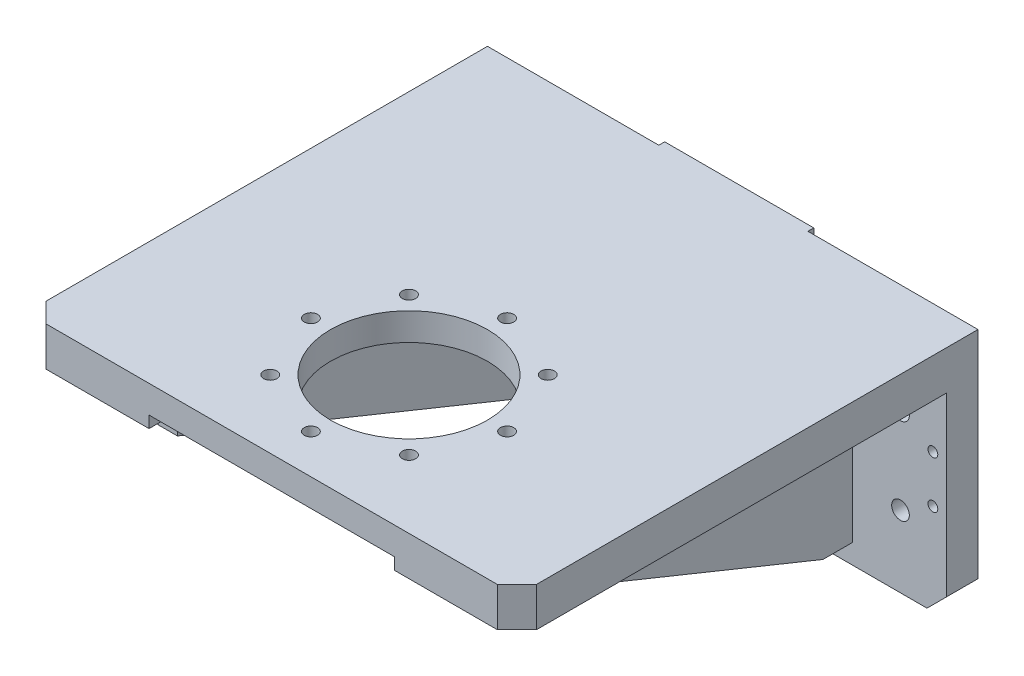
from build123d import *

# Parameters (mm, degrees)
SKETCH1_W                         = 250
SKETCH1_H                         = 120
BOSS_EXTRUDE1_DEPTH               = 16
SKETCH2_W                         = 250
SKETCH2_H                         = 20
BOSS_EXTRUDE2_DEPTH               = 235
GUSSET1_START                     = 192
GUSSET1_DEPTH                     = 10
GUSSET2_START                     = 48
GUSSET2_DEPTH                     = 10
SKETCH5_W                         = 76
SKETCH5_H                         = 120
BOSS_EXTRUDE3_DEPTH               = 3
SKETCH6_W                         = 125
SKETCH6_H                         = 140
CUT_EXTRUDE1_DEPTH                = 6
SKETCH7_R                         = 40
CUT_EXTRUDE2_DEPTH                = 360.111403328
SKETCH10_W                        = 3.4
SKETCH10_H                        = 14
M8_TAPPED_HOLE1_AT_2_COUNT        = 2
M8_TAPPED_HOLE1_AT_2_PITCH        = 70.710678119
M8_TAPPED_HOLE1_AT_3_COUNT        = 2
M8_TAPPED_HOLE1_AT_3_PITCH        = 100
M8_TAPPED_HOLE1_AT_4_COUNT        = 2
M8_TAPPED_HOLE1_AT_4_PITCH        = 70.710678119
M8_TAPPED_HOLE1_AT_5_COUNT        = 2
M8_TAPPED_HOLE1_AT_5_PITCH        = 92.387953251
M8_TAPPED_HOLE1_AT_6_COUNT        = 2
M8_TAPPED_HOLE1_AT_6_PITCH        = 38.268343237
M8_TAPPED_HOLE1_AT_7_COUNT        = 2
M8_TAPPED_HOLE1_AT_7_PITCH        = 92.387953251
M8_TAPPED_HOLE1_AT_8_COUNT        = 2
M8_TAPPED_HOLE1_AT_8_PITCH        = 38.268343237
M5_TAPPED_HOLE1_AT_2_COUNT        = 2
M5_TAPPED_HOLE1_AT_2_PITCH        = 44.345519866
SKETCH16_W                        = 4.5
SKETCH16_H                        = 19
F_9_0_9_DIAMETER_HOLE1_AT_2_COUNT = 2
F_9_0_9_DIAMETER_HOLE1_AT_2_PITCH = 44
F_9_0_9_DIAMETER_HOLE1_AT_3_COUNT = 2
F_9_0_9_DIAMETER_HOLE1_AT_3_PITCH = 57
F_9_0_9_DIAMETER_HOLE1_AT_4_COUNT = 2
F_9_0_9_DIAMETER_HOLE1_AT_4_PITCH = 72.00694411
F_9_0_9_DIAMETER_HOLE1_AT_5_COUNT = 2
F_9_0_9_DIAMETER_HOLE1_AT_5_PITCH = 146
F_9_0_9_DIAMETER_HOLE1_AT_6_COUNT = 2
F_9_0_9_DIAMETER_HOLE1_AT_6_PITCH = 152.486064937
F_9_0_9_DIAMETER_HOLE1_AT_7_COUNT = 2
F_9_0_9_DIAMETER_HOLE1_AT_7_PITCH = 203
F_9_0_9_DIAMETER_HOLE1_AT_8_COUNT = 2
F_9_0_9_DIAMETER_HOLE1_AT_8_PITCH = 207.713745332
SKETCH18_W                        = 2.5
SKETCH18_H                        = 19
TAP_DRILL_FOR_M6_TAP1_AT_2_COUNT  = 2
TAP_DRILL_FOR_M6_TAP1_AT_2_PITCH  = 24
TAP_DRILL_FOR_M6_TAP1_AT_3_COUNT  = 2
TAP_DRILL_FOR_M6_TAP1_AT_3_PITCH  = 236
TAP_DRILL_FOR_M6_TAP1_AT_4_COUNT  = 2
TAP_DRILL_FOR_M6_TAP1_AT_4_PITCH  = 237.217200051
CHAMFER1_SIZE                     = 10


# Read off the part's stored shape, not the designer's step: Gusset1, Gusset2
with BuildPart() as part:
    # Sketch1 → Boss-Extrude1 (new body)
    with BuildSketch(Plane.XY):
        with Locations((125, 60)):
            Rectangle(SKETCH1_W, SKETCH1_H)
    extrude(amount=BOSS_EXTRUDE1_DEPTH)

    # Sketch2 → Boss-Extrude2 (add)
    with BuildSketch(Plane.XY):
        with Locations((125, 110)):
            Rectangle(SKETCH2_W, SKETCH2_H)
    extrude(amount=BOSS_EXTRUDE2_DEPTH)

    # Sketch5 → Boss-Extrude3 (add)
    with BuildSketch(Plane(origin=(0, 0, 0), x_dir=(-1, 0, 0), z_dir=(0, 0, -1))):
        with Locations((-125.298445595, 60)):
            Rectangle(SKETCH5_W, SKETCH5_H)
    extrude(amount=BOSS_EXTRUDE3_DEPTH)

    # Sketch6 → Cut-Extrude1 (cut)
    with BuildSketch(Plane.XZ.offset(-100)):
        with Locations((125, 165)):
            Rectangle(SKETCH6_W, SKETCH6_H)
    extrude(amount=-CUT_EXTRUDE1_DEPTH, mode=Mode.SUBTRACT)

    # Sketch7 → Cut-Extrude2 (cut, through all)
    with BuildSketch(Plane.XZ.offset(-106)):
        with Locations(Location((125, 165, 0), (0, 0, 270))):
            Circle(SKETCH7_R)
    extrude(amount=-CUT_EXTRUDE2_DEPTH, mode=Mode.SUBTRACT)

    # Sketch10 → M8 Tapped Hole1 (revolve, cut)
    with BuildSketch(Plane(origin=(125, 106, 215), x_dir=(0, 0, -1), z_dir=(1, 0, 0))):
        with Locations((1.7, 7)):
            Rectangle(SKETCH10_W, SKETCH10_H)
    m8_tapped_hole1 = revolve(axis=Axis((125, 99.65, 215), (0, 1, 0)), mode=Mode.SUBTRACT)

    # M8 Tapped Hole1 at 2: M8 Tapped Hole1 ×2
    with Locations(*[Vector(-0.7071067811865476, 0, -0.7071067811865476) * (i * M8_TAPPED_HOLE1_AT_2_PITCH) for i in range(1, M8_TAPPED_HOLE1_AT_2_COUNT)]):
        add(m8_tapped_hole1, mode=Mode.SUBTRACT)

    # M8 Tapped Hole1 at 3: M8 Tapped Hole1 ×2
    with Locations(*[(0, 0, -i * M8_TAPPED_HOLE1_AT_3_PITCH) for i in range(1, M8_TAPPED_HOLE1_AT_3_COUNT)]):
        add(m8_tapped_hole1, mode=Mode.SUBTRACT)

    # M8 Tapped Hole1 at 4: M8 Tapped Hole1 ×2
    with Locations(*[Vector(0.7071067811865477, 0, -0.7071067811865475) * (i * M8_TAPPED_HOLE1_AT_4_PITCH) for i in range(1, M8_TAPPED_HOLE1_AT_4_COUNT)]):
        add(m8_tapped_hole1, mode=Mode.SUBTRACT)

    # M8 Tapped Hole1 at 5: M8 Tapped Hole1 ×2
    with Locations(*[Vector(-0.38268343236508917, 0, -0.9238795325112871) * (i * M8_TAPPED_HOLE1_AT_5_PITCH) for i in range(1, M8_TAPPED_HOLE1_AT_5_COUNT)]):
        add(m8_tapped_hole1, mode=Mode.SUBTRACT)

    # M8 Tapped Hole1 at 6: M8 Tapped Hole1 ×2
    with Locations(*[Vector(-0.9238795325112872, 0, -0.3826834323650889) * (i * M8_TAPPED_HOLE1_AT_6_PITCH) for i in range(1, M8_TAPPED_HOLE1_AT_6_COUNT)]):
        add(m8_tapped_hole1, mode=Mode.SUBTRACT)

    # M8 Tapped Hole1 at 7: M8 Tapped Hole1 ×2
    with Locations(*[Vector(0.3826834323650889, 0, -0.9238795325112871) * (i * M8_TAPPED_HOLE1_AT_7_PITCH) for i in range(1, M8_TAPPED_HOLE1_AT_7_COUNT)]):
        add(m8_tapped_hole1, mode=Mode.SUBTRACT)

    # M8 Tapped Hole1 at 8: M8 Tapped Hole1 ×2
    with Locations(*[Vector(0.9238795325112875, 0, -0.3826834323650881) * (i * M8_TAPPED_HOLE1_AT_8_PITCH) for i in range(1, M8_TAPPED_HOLE1_AT_8_COUNT)]):
        add(m8_tapped_hole1, mode=Mode.SUBTRACT)

    # Sketch12 → M5 Tapped Hole1 (revolve, cut)
    with BuildSketch(Plane(origin=(104.73095223, 0, 7), x_dir=(0, 0, -1), z_dir=(1, 0, 0))):
        Polygon((0, 0), (0, 11.2618073), (2.1, 10), (2.1, 0), align=None)
    m5_tapped_hole1 = revolve(axis=Axis((104.73095223, -6.35, 7), (0, 1, 0)), mode=Mode.SUBTRACT)

    # M5 Tapped Hole1 at 2: M5 Tapped Hole1 ×2
    with Locations(*[(i * M5_TAPPED_HOLE1_AT_2_PITCH, 0, 0) for i in range(1, M5_TAPPED_HOLE1_AT_2_COUNT)]):
        add(m5_tapped_hole1, mode=Mode.SUBTRACT)

    # Sketch16 → Ø9.0 (9) Diameter Hole1 (revolve, cut)
    with BuildSketch(Plane(origin=(23.5, 80.5, 16), x_dir=(0, -1, 0), z_dir=(1, 0, 0))):
        with Locations((2.25, 9.5)):
            Rectangle(SKETCH16_W, SKETCH16_H)
    f_9_0_9_diameter_hole1 = revolve(axis=Axis((23.5, 80.5, 22.35), (0, 0, -1)), mode=Mode.SUBTRACT)

    # Ø9.0 (9) Diameter Hole1 at 2: Ø9.0 (9) Diameter Hole1 ×2
    with Locations(*[(0, -i * F_9_0_9_DIAMETER_HOLE1_AT_2_PITCH, 0) for i in range(1, F_9_0_9_DIAMETER_HOLE1_AT_2_COUNT)]):
        add(f_9_0_9_diameter_hole1, mode=Mode.SUBTRACT)

    # Ø9.0 (9) Diameter Hole1 at 3: Ø9.0 (9) Diameter Hole1 ×2
    with Locations(*[(i * F_9_0_9_DIAMETER_HOLE1_AT_3_PITCH, 0, 0) for i in range(1, F_9_0_9_DIAMETER_HOLE1_AT_3_COUNT)]):
        add(f_9_0_9_diameter_hole1, mode=Mode.SUBTRACT)

    # Ø9.0 (9) Diameter Hole1 at 4: Ø9.0 (9) Diameter Hole1 ×2
    with Locations(*[Vector(0.79159032097319, -0.6110521775933395, 0) * (i * F_9_0_9_DIAMETER_HOLE1_AT_4_PITCH) for i in range(1, F_9_0_9_DIAMETER_HOLE1_AT_4_COUNT)]):
        add(f_9_0_9_diameter_hole1, mode=Mode.SUBTRACT)

    # Ø9.0 (9) Diameter Hole1 at 5: Ø9.0 (9) Diameter Hole1 ×2
    with Locations(*[(i * F_9_0_9_DIAMETER_HOLE1_AT_5_PITCH, 0, 0) for i in range(1, F_9_0_9_DIAMETER_HOLE1_AT_5_COUNT)]):
        add(f_9_0_9_diameter_hole1, mode=Mode.SUBTRACT)

    # Ø9.0 (9) Diameter Hole1 at 6: Ø9.0 (9) Diameter Hole1 ×2
    with Locations(*[Vector(0.9574645398596204, -0.2885509572179678, 0) * (i * F_9_0_9_DIAMETER_HOLE1_AT_6_PITCH) for i in range(1, F_9_0_9_DIAMETER_HOLE1_AT_6_COUNT)]):
        add(f_9_0_9_diameter_hole1, mode=Mode.SUBTRACT)

    # Ø9.0 (9) Diameter Hole1 at 7: Ø9.0 (9) Diameter Hole1 ×2
    with Locations(*[(i * F_9_0_9_DIAMETER_HOLE1_AT_7_PITCH, 0, 0) for i in range(1, F_9_0_9_DIAMETER_HOLE1_AT_7_COUNT)]):
        add(f_9_0_9_diameter_hole1, mode=Mode.SUBTRACT)

    # Ø9.0 (9) Diameter Hole1 at 8: Ø9.0 (9) Diameter Hole1 ×2
    with Locations(*[Vector(0.9773065315209362, -0.21182998712769055, 0) * (i * F_9_0_9_DIAMETER_HOLE1_AT_8_PITCH) for i in range(1, F_9_0_9_DIAMETER_HOLE1_AT_8_COUNT)]):
        add(f_9_0_9_diameter_hole1, mode=Mode.SUBTRACT)

    # Sketch18 → Tap Drill for M6 Tap1 (revolve, cut)
    with BuildSketch(Plane(origin=(7, 70.5, 16), x_dir=(0, -1, 0), z_dir=(1, 0, 0))):
        with Locations((1.25, 9.5)):
            Rectangle(SKETCH18_W, SKETCH18_H)
    tap_drill_for_m6_tap1 = revolve(axis=Axis((7, 70.5, 22.35), (0, 0, -1)), mode=Mode.SUBTRACT)

    # Tap Drill for M6 Tap1 at 2: Tap Drill for M6 Tap1 ×2
    with Locations(*[(0, -i * TAP_DRILL_FOR_M6_TAP1_AT_2_PITCH, 0) for i in range(1, TAP_DRILL_FOR_M6_TAP1_AT_2_COUNT)]):
        add(tap_drill_for_m6_tap1, mode=Mode.SUBTRACT)

    # Tap Drill for M6 Tap1 at 3: Tap Drill for M6 Tap1 ×2
    with Locations(*[(i * TAP_DRILL_FOR_M6_TAP1_AT_3_PITCH, 0, 0) for i in range(1, TAP_DRILL_FOR_M6_TAP1_AT_3_COUNT)]):
        add(tap_drill_for_m6_tap1, mode=Mode.SUBTRACT)

    # Tap Drill for M6 Tap1 at 4: Tap Drill for M6 Tap1 ×2
    with Locations(*[Vector(0.9948688372906245, -0.10117310209735164, 0) * (i * TAP_DRILL_FOR_M6_TAP1_AT_4_PITCH) for i in range(1, TAP_DRILL_FOR_M6_TAP1_AT_4_COUNT)]):
        add(tap_drill_for_m6_tap1, mode=Mode.SUBTRACT)

    # Chamfer1
    chamfer1_edges = [part.edges().sort_by_distance(p)[0] for p in [
        (0, 110, 235),
        (250, 110, 235),
        (250, 0, 8),
        (0, 0, 8),
    ]]
    chamfer(chamfer1_edges, length=CHAMFER1_SIZE)


with BuildPart() as body_2:
    # Gusset1 outline → Gusset1 (new body)
    with BuildSketch(Plane.YZ.offset(GUSSET1_START)):
        Polygon((100, 216), (85, 216), (10, 31), (10, 16), (100, 16), align=None)
    extrude(amount=GUSSET1_DEPTH)


with BuildPart() as body_3:
    # Gusset2 outline → Gusset2 (new body)
    with BuildSketch(Plane.YZ.offset(GUSSET2_START)):
        Polygon((100, 216), (85, 216), (10, 31), (10, 16), (100, 16), align=None)
    extrude(amount=GUSSET2_DEPTH)


solid = Compound([part.part, body_2.part, body_3.part])
